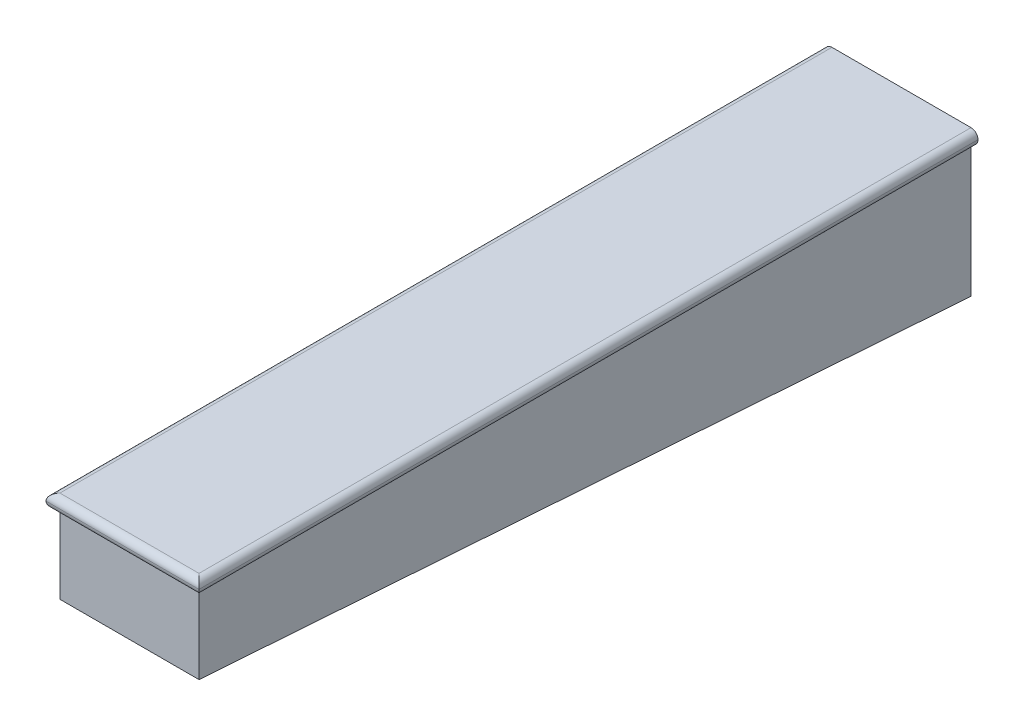
from build123d import *

# Parameters (mm, degrees)
SKETCH1_W           = 22
SKETCH1_H           = 112
BOSS_EXTRUDE1_DEPTH = 21
CUT_EXTRUDE1_DEPTH  = 19
FILLET1_START       = -1
FILLET1_DEPTH       = 113
FILLET1_2_DEPTH     = 113
FILLET1_3_DEPTH     = 24
CUT_EXTRUDE11_DEPTH = 116.870617501


with BuildPart() as part:
    # Sketch1 → Boss-Extrude1 (new body)
    with BuildSketch(Plane(origin=(0, 0, 0), x_dir=(1, 0, 0), z_dir=(0, 1, 0))):
        with Locations((11, -56)):
            Rectangle(SKETCH1_W, SKETCH1_H)
    extrude(amount=BOSS_EXTRUDE1_DEPTH)

    # Sketch2 → Cut-Extrude1 (cut)
    with BuildSketch(Plane.XZ):
        Polygon((0, 112), (22, 112), (22, 0), (21, 0), (21, 111), (1, 111), (1, 0), (0, 0), align=None)
    extrude(amount=-CUT_EXTRUDE1_DEPTH, mode=Mode.SUBTRACT)

    # Fillet1: read off the stored shape, not the designer's step
    # Fillet1 outline → Fillet1 (cut)
    with BuildSketch(Plane.XY.offset(FILLET1_START)):
        with BuildLine():
            Line((0, 19), (1, 19))
            ThreePointArc((1, 19), (0.292893219, 19.292893219), (0, 20))
            Line((0, 20), (0, 19))
        make_face()
        with BuildLine():
            ThreePointArc((22, 20), (21.707106781, 19.292893219), (21, 19))
            Line((21, 19), (22, 19))
            Line((22, 19), (22, 20))
        make_face()
    extrude(amount=FILLET1_DEPTH, mode=Mode.SUBTRACT)

    # Fillet1 2 outline → Fillet1 2 (cut)
    with BuildSketch(Plane.XY.offset(FILLET1_START)):
        with BuildLine():
            Line((0, 21), (0, 20))
            ThreePointArc((0, 20), (0.292893219, 20.707106781), (1, 21))
            Line((1, 21), (0, 21))
        make_face()
        with BuildLine():
            Line((22, 21), (21, 21))
            ThreePointArc((21, 21), (21.707106781, 20.707106781), (22, 20))
            Line((22, 20), (22, 21))
        make_face()
    extrude(amount=FILLET1_2_DEPTH, mode=Mode.SUBTRACT)

    # Fillet1 3 outline → Fillet1 3 (cut)
    with BuildSketch(Plane.YZ.offset(FILLET1_START)):
        with BuildLine():
            Line((21, 112), (20, 112))
            ThreePointArc((20, 112), (20.707106781, 111.707106781), (21, 111))
            Line((21, 111), (21, 112))
        make_face()
        with BuildLine():
            ThreePointArc((19, 111), (19.292893219, 111.707106781), (20, 112))
            Line((20, 112), (19, 112))
            Line((19, 112), (19, 111))
        make_face()
    extrude(amount=FILLET1_3_DEPTH, mode=Mode.SUBTRACT)

    # Sketch11 → Cut-Extrude11 (cut, through all)
    with BuildSketch(Plane.ZY.offset(-1)):
        Polygon((0, 0), (111, 0), (111, 7.767718463), align=None)
    extrude(amount=-CUT_EXTRUDE11_DEPTH, mode=Mode.SUBTRACT)


solid = part.part
